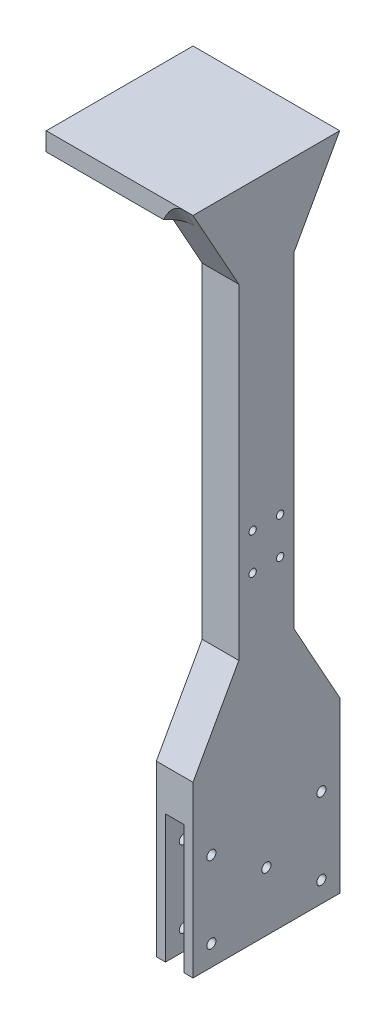
from build123d import *

# Parameters (mm, degrees)
SUPPORT_BALISE_W                           = 20
SUPPORT_BALISE_H                           = 350
SUPPORT_BALISE_BOSSAGE_DEPTH               = 80
ESQUISSE3_W                                = 80
ESQUISSE3_H                                = 80
SUPPORT_CHEVAL_ENLEVEMENT_DE_MATIERE_DEPTH = 10
ESQUISSE8_W                                = 10
ESQUISSE8_H                                = 70
SUPPORT_CHEVAL_DEPTH                       = 80
VIS_REACH                                  = 376.466
SERRAGE_VIS_R                              = 2.5
VIS_DIRECTION_2_DEPTH                      = 375.466286867
ENL_V_MAT_EXTRU_5_DEPTH                    = 20
POUR_IMPRESSION_R                          = 15
FIXATION_POUR_ASSEMBLAGE_R                 = 2
VIS_POUR_ASSEMBLAGE_DEPTH                  = 20


with BuildPart() as part:
    # Support Balise → Support balise bossage (new body)
    with BuildSketch(Plane.XY):
        with Locations((10, 175)):
            Rectangle(SUPPORT_BALISE_W, SUPPORT_BALISE_H)
    extrude(amount=SUPPORT_BALISE_BOSSAGE_DEPTH)

    # Esquisse3 → Support Cheval enlevement de matiere (add)
    with BuildSketch(Plane(origin=(0, 350, 0), x_dir=(1, 0, 0), z_dir=(0, 1, 0))):
        with Locations((-20, -40)):
            Rectangle(ESQUISSE3_W, ESQUISSE3_H)
    extrude(amount=SUPPORT_CHEVAL_ENLEVEMENT_DE_MATIERE_DEPTH)

    # Esquisse8 → Support Cheval (cut)
    with BuildSketch(Plane.XY.offset(80)):
        with Locations((10, 35)):
            Rectangle(ESQUISSE8_W, ESQUISSE8_H)
    extrude(amount=-SUPPORT_CHEVAL_DEPTH, mode=Mode.SUBTRACT)

    # Vis: up to this face of the body (flat: up to its plane)
    vis_end = Plane(part.part.faces().sort_by_distance((0, 175, 40))[0])
    # Serrage vis → Vis (cut, up to the picked face)
    with BuildSketch(Plane(origin=(5, 0, 0), x_dir=(0, 0, -1), z_dir=(1, 0, 0)), mode=Mode.PRIVATE) as vis_sk1:
        with Locations((-70, 11.284552026)):
            Circle(SERRAGE_VIS_R)
    vis_tool1 = split(extrude(vis_sk1.sketch, amount=-VIS_REACH, mode=Mode.PRIVATE), bisect_by=vis_end, keep=Keep.BOTH, mode=Mode.PRIVATE)
    # Serrage vis → Vis (cut, up to the picked face)
    with BuildSketch(Plane(origin=(5, 0, 0), x_dir=(0, 0, -1), z_dir=(1, 0, 0)), mode=Mode.PRIVATE) as vis_sk2:
        with Locations((-70, 53.057184379)):
            Circle(SERRAGE_VIS_R)
    vis_tool2 = split(extrude(vis_sk2.sketch, amount=-VIS_REACH, mode=Mode.PRIVATE), bisect_by=vis_end, keep=Keep.BOTH, mode=Mode.PRIVATE)
    # Serrage vis → Vis (cut, up to the picked face)
    with BuildSketch(Plane(origin=(5, 0, 0), x_dir=(0, 0, -1), z_dir=(1, 0, 0)), mode=Mode.PRIVATE) as vis_sk3:
        with Locations((-10, 53.057184379)):
            Circle(SERRAGE_VIS_R)
    vis_tool3 = split(extrude(vis_sk3.sketch, amount=-VIS_REACH, mode=Mode.PRIVATE), bisect_by=vis_end, keep=Keep.BOTH, mode=Mode.PRIVATE)
    # Serrage vis → Vis (cut, up to the picked face)
    with BuildSketch(Plane(origin=(5, 0, 0), x_dir=(0, 0, -1), z_dir=(1, 0, 0)), mode=Mode.PRIVATE) as vis_sk4:
        with Locations((-10, 11.284552026)):
            Circle(SERRAGE_VIS_R)
    vis_tool4 = split(extrude(vis_sk4.sketch, amount=-VIS_REACH, mode=Mode.PRIVATE), bisect_by=vis_end, keep=Keep.BOTH, mode=Mode.PRIVATE)
    # Serrage vis → Vis (cut, up to the picked face)
    with BuildSketch(Plane(origin=(5, 0, 0), x_dir=(0, 0, -1), z_dir=(1, 0, 0)), mode=Mode.PRIVATE) as vis_sk5:
        with Locations((-40, 32.170868202)):
            Circle(SERRAGE_VIS_R)
    vis_tool5 = split(extrude(vis_sk5.sketch, amount=-VIS_REACH, mode=Mode.PRIVATE), bisect_by=vis_end, keep=Keep.BOTH, mode=Mode.PRIVATE)
    add(vis_tool1.solids().sort_by(Axis((5, 11.284552, 70), (-1, 0, 0)))[0], mode=Mode.SUBTRACT)
    add(vis_tool2.solids().sort_by(Axis((5, 53.057184, 70), (-1, 0, 0)))[0], mode=Mode.SUBTRACT)
    add(vis_tool3.solids().sort_by(Axis((5, 53.057184, 10), (-1, 0, 0)))[0], mode=Mode.SUBTRACT)
    add(vis_tool4.solids().sort_by(Axis((5, 11.284552, 10), (-1, 0, 0)))[0], mode=Mode.SUBTRACT)
    add(vis_tool5.solids().sort_by(Axis((5, 32.170868, 40), (-1, 0, 0)))[0], mode=Mode.SUBTRACT)

    # Serrage vis → Vis direction 2 (cut)
    with BuildSketch(Plane(origin=(5, 0, 0), x_dir=(0, 0, -1), z_dir=(1, 0, 0))):
        with Locations((-70, 11.284552026)):
            Circle(SERRAGE_VIS_R)
        with Locations((-70, 53.057184379)):
            Circle(SERRAGE_VIS_R)
        with Locations((-10, 53.057184379)):
            Circle(SERRAGE_VIS_R)
        with Locations((-10, 11.284552026)):
            Circle(SERRAGE_VIS_R)
        with Locations((-40, 32.170868202)):
            Circle(SERRAGE_VIS_R)
    extrude(amount=VIS_DIRECTION_2_DEPTH, mode=Mode.SUBTRACT)

    # Design → Enlèv. mat.-Extru.5 (cut)
    with BuildSketch(Plane(origin=(20, 0, 0), x_dir=(0, 0, -1), z_dir=(1, 0, 0))):
        Polygon((-55, 315), (-80, 360), (-80, 92.406088827), (-55, 137.406088827), align=None)
        Polygon((0, 92.406088827), (0, 360), (-25, 315), (-25, 137.406088827), align=None)
    extrude(amount=-ENL_V_MAT_EXTRU_5_DEPTH, mode=Mode.SUBTRACT)

    # Pour Impression
    # the kernel refuses this fillet: 15 mm, written as the material it adds along each edge
    with BuildSketch(Plane(origin=(0, 392.780897855, -18.211609919), x_dir=(1, 0, 0), z_dir=(0, -0.8741572761215375, 0.48564293117863266))) as pour_impression_piece_1_section:
        with BuildLine():
            CenterArc((POUR_IMPRESSION_R, -POUR_IMPRESSION_R), POUR_IMPRESSION_R, 90, 90)
            Line((0, -POUR_IMPRESSION_R), (0, 0))
            Line((0, 0), (POUR_IMPRESSION_R, 0))
        make_face()
    pour_impression_piece_1 = extrude(amount=86.439589046, mode=Mode.PRIVATE)
    pour_impression_piece_1 = split(pour_impression_piece_1, bisect_by=Plane(origin=(4.741525676, 350, 2.029382941), z_dir=(0, 1, 0)), keep=Keep.TOP, mode=Mode.PRIVATE)
    pour_impression_piece_1 = split(pour_impression_piece_1, bisect_by=Plane(origin=(4.741525676, 353.652889294, 0), z_dir=(0, 0, 1)), keep=Keep.TOP, mode=Mode.PRIVATE)
    add(pour_impression_piece_1)
    with BuildSketch(Plane(origin=(0, 317.219102145, 56.232834525), x_dir=(1, 0, 0), z_dir=(0, 0.8741572761215377, 0.4856429311786322))) as pour_impression_piece_2_section:
        with BuildLine():
            CenterArc((POUR_IMPRESSION_R, -POUR_IMPRESSION_R), POUR_IMPRESSION_R, 90, 90)
            Line((0, -POUR_IMPRESSION_R), (0, 0))
            Line((0, 0), (POUR_IMPRESSION_R, 0))
        make_face()
    pour_impression_piece_2 = extrude(amount=86.439589046, mode=Mode.PRIVATE)
    pour_impression_piece_2 = split(pour_impression_piece_2, bisect_by=Plane(origin=(4.741525676, 350, 77.970617059), z_dir=(0, 1, 0)), keep=Keep.TOP, mode=Mode.PRIVATE)
    pour_impression_piece_2 = split(pour_impression_piece_2, bisect_by=Plane(origin=(4.741525676, 353.652889294, 80), z_dir=(0, 0, -1)), keep=Keep.TOP, mode=Mode.PRIVATE)
    add(pour_impression_piece_2)

    # Fixation pour assemblage → Vis pour Assemblage (cut)
    with BuildSketch(Plane(origin=(20, 0, 0), x_dir=(0, 0, -1), z_dir=(1, 0, 0))):
        with Locations((-47.5, 195)):
            Circle(FIXATION_POUR_ASSEMBLAGE_R)
        with Locations((-32.5, 195)):
            Circle(FIXATION_POUR_ASSEMBLAGE_R)
        with Locations((-32.5, 175)):
            Circle(FIXATION_POUR_ASSEMBLAGE_R)
        with Locations((-47.5, 175)):
            Circle(FIXATION_POUR_ASSEMBLAGE_R)
    extrude(amount=-VIS_POUR_ASSEMBLAGE_DEPTH, mode=Mode.SUBTRACT)


solid = part.part
